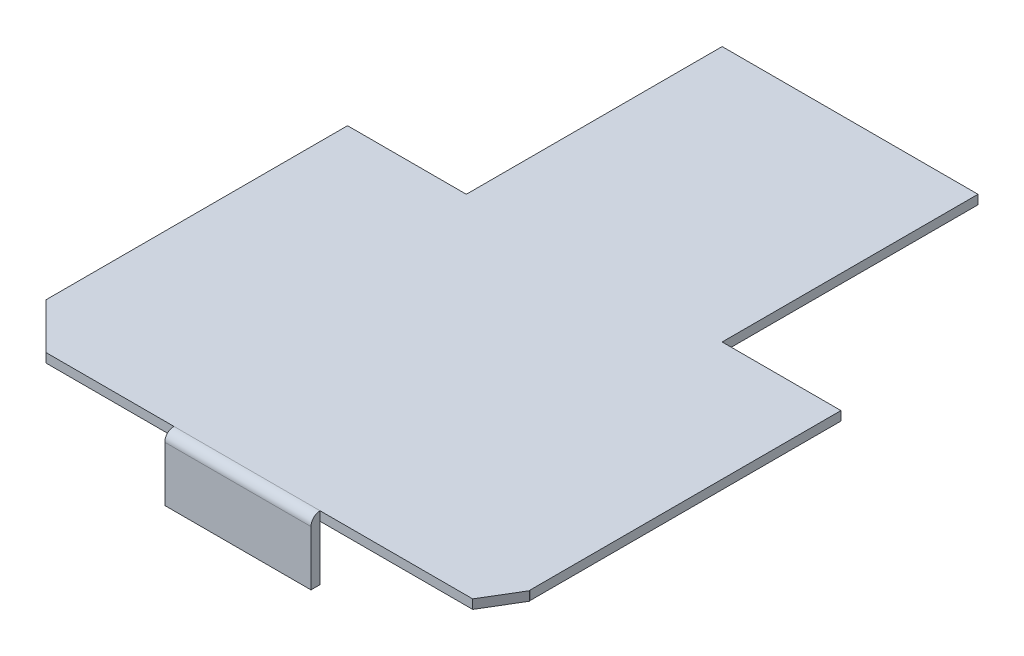
from build123d import *

# Parameters (mm, degrees)
SKETCH1_W           = 171.45
SKETCH1_H           = 107.95
BOSS_EXTRUDE1_DEPTH = 3.175
BOSS_EXTRUDE2_DEPTH = 3.175
SKETCH4_W           = 50.8
SKETCH4_H           = 3.175
BOSS_EXTRUDE3_DEPTH = 19.05
CHAMFER1_SIZE       = 12.7
CHAMFER1_SIZE_2     = 10.472688289
CHAMFER1_SIZE_3     = 17.454480482
SKETCH6_W           = 88.9
SKETCH6_H           = 88.9
BOSS_EXTRUDE4_DEPTH = 3.175
BOSS_EXTRUDE7_DEPTH = 50.8


with BuildPart() as part:
    # Sketch1 → Boss-Extrude1 (new body)
    with BuildSketch(Plane(origin=(0, 0, 0), x_dir=(1, 0, 0), z_dir=(0, 1, 0))):
        Rectangle(SKETCH1_W, SKETCH1_H)
    extrude(amount=BOSS_EXTRUDE1_DEPTH)

    # Sketch2 → Boss-Extrude2 (add)
    with BuildSketch(Plane(origin=(0, 3.175, 0), x_dir=(1, 0, 0), z_dir=(0, 1, 0))):
        Polygon((-85.725, -53.975), (-82.55, -66.675), (88.9, -66.675), (85.725, -53.975), align=None)
    extrude(amount=-BOSS_EXTRUDE2_DEPTH)

    # Chamfer1
    # the kernel refuses this chamfer: 17.454480482, 12.7, 10.472688289 mm, written as the material it takes off along each edge
    with BuildSketch(Plane(origin=(88.9, 35.835373947, 66.675), x_dir=(-0.21576900793941634, 0, -0.9764444352920651), z_dir=(0, -1, 0))) as chamfer1_piece_1:
        Polygon((CHAMFER1_SIZE * 0.999621916911, -CHAMFER1_SIZE * 0.0274958766106), (CHAMFER1_SIZE_2 * 0.215769007941, -CHAMFER1_SIZE_2 * 0.976444435298), (0, 0), align=None)
    extrude(amount=68.495747894, mode=Mode.SUBTRACT)
    with BuildSketch(Plane(origin=(-82.55, 48.316843842, 66.675), x_dir=(0.9993006642791182, 0, 0.0373922768939412), z_dir=(0, -1, 0))) as chamfer1_piece_2:
        Polygon((CHAMFER1_SIZE * 0.999300664279, -CHAMFER1_SIZE * 0.0373922768939), (-CHAMFER1_SIZE_3 * 0.278641848199, -CHAMFER1_SIZE_3 * 0.960395085581), (0, 0), align=None)
    extrude(amount=93.458687684, mode=Mode.SUBTRACT)

    # Sketch6 → Boss-Extrude4 (add)
    with BuildSketch(Plane(origin=(0, 3.175, 0), x_dir=(1, 0, 0), z_dir=(0, 1, 0))):
        with Locations((0, 98.425)):
            Rectangle(SKETCH6_W, SKETCH6_H)
    extrude(amount=-BOSS_EXTRUDE4_DEPTH)



with BuildPart() as body_2:
    # Sketch4 → Boss-Extrude3 (new body)
    with BuildSketch(Plane.XZ):
        with Locations((0, 68.2625)):
            Rectangle(SKETCH4_W, SKETCH4_H)
    extrude(amount=BOSS_EXTRUDE3_DEPTH)


with BuildPart() as part_1:
    add(part.part)

    add(body_2.part)  # Boss-Extrude7 merges body 2
    # Sketch10 → Boss-Extrude7 (add)
    with BuildSketch(Plane(origin=(25.4, 0, 0), x_dir=(0, 0, -1), z_dir=(1, 0, 0))):
        with BuildLine():
            Line((-66.675, 3.175), (-66.675, 0))
            Line((-66.675, 0), (-69.85, 0))
            ThreePointArc((-69.85, 0), (-68.92006403, 2.24506403), (-66.675, 3.175))
        make_face()
    extrude(amount=-BOSS_EXTRUDE7_DEPTH)


solid = part_1.part
